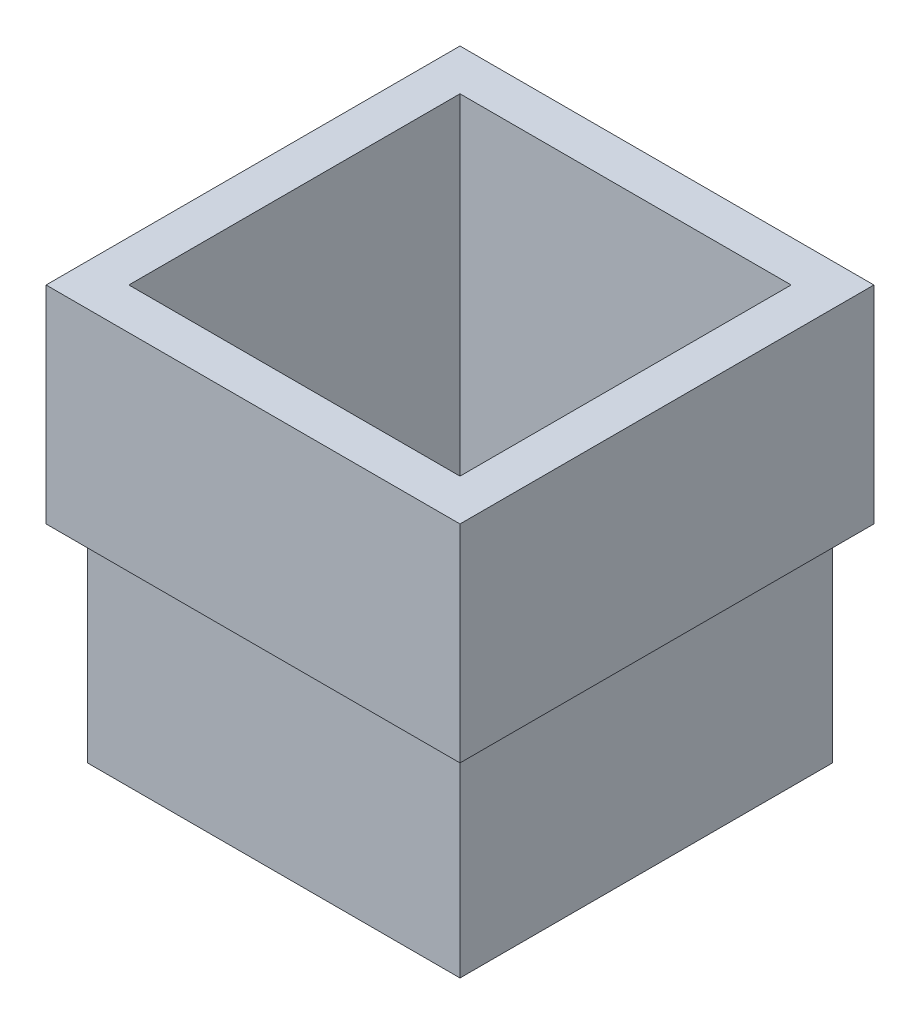
from build123d import *

# Parameters (mm, degrees)
SKETCH1_W           = 50
SKETCH1_H           = 50
SKETCH1_W_2         = 40
SKETCH1_H_2         = 40
BOSS_EXTRUDE1_DEPTH = 25
SKETCH1_3_W         = 45
SKETCH1_3_H         = 45
SKETCH1_3_W_2       = 40
SKETCH1_3_H_2       = 40
BOSS_EXTRUDE2_DEPTH = 25


with BuildPart() as part:
    # Sketch1 → Boss-Extrude1 (new body)
    with BuildSketch(Plane(origin=(0, 0, 0), x_dir=(1, 0, 0), z_dir=(0, 1, 0))):
        Rectangle(SKETCH1_W, SKETCH1_H)
        Rectangle(SKETCH1_W_2, SKETCH1_H_2, mode=Mode.SUBTRACT)
    extrude(amount=BOSS_EXTRUDE1_DEPTH)

    # Sketch1<3> → Boss-Extrude2 (add)
    with BuildSketch(Plane(origin=(0, 0, 0), x_dir=(1, 0, 0), z_dir=(0, 1, 0))):
        Rectangle(SKETCH1_3_W, SKETCH1_3_H)
        Rectangle(SKETCH1_3_W_2, SKETCH1_3_H_2, mode=Mode.SUBTRACT)
    extrude(amount=-BOSS_EXTRUDE2_DEPTH)


solid = part.part
